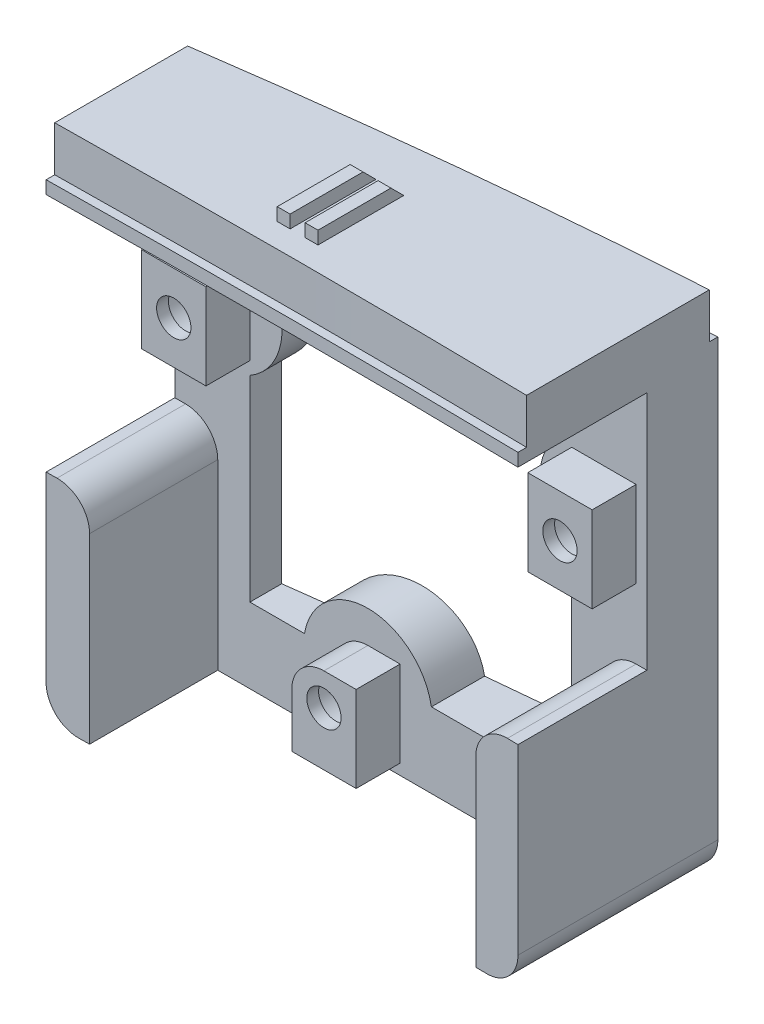
from build123d import *

# Parameters (mm, degrees)
BOSS_EXTRUDE2_DEPTH     = 47.8
CUT_EXTRUDE1_DEPTH      = 4.2
CUT_EXTRUDE2_START      = -5.4
CUT_EXTRUDE2_DEPTH      = 53.536189994
SKETCH3_R               = 2.5
CUT_EXTRUDE3_DEPTH      = 58.376025302
SKETCH4_W               = 6
SKETCH4_H               = 8
BOSS_EXTRUDE4_DEPTH     = 4.1
CUT_EXTRUDE6_DEPTH      = 58.376025302
CUT_EXTRUDE6_DEPTH_BACK = 58.376025302
SKETCH8_R               = 1.6
SKETCH10_8_R            = 2.7
SKETCH9_8_R             = 2.5
SKETCH10_9_R            = 2.7
SKETCH9_9_R             = 2.5
SKETCH12_R              = 2.5
CUT_EXTRUDE10_DEPTH     = 57.923372061
CUT_EXTRUDE11_START     = -1.2
SKETCH13_R              = 3
CUT_EXTRUDE11_DEPTH     = 57.176025302
CUT_EXTRUDE15_START     = -6.623319985
CUT_EXTRUDE15_DEPTH     = 6.623319985
SKETCH1_4_W             = 1.2
SKETCH1_4_H             = 8
BOSS_EXTRUDE5_DEPTH     = 1.2
BOSS_EXTRUDE6_START     = 42.4
BOSS_EXTRUDE6_DEPTH     = 20
FILLET1_R               = 3
CHAMFER1_SIZE           = 1.2


with BuildPart() as part:
    # Sketch1 → Boss-Extrude2 (new body)
    with BuildSketch(Plane(origin=(0, 0, 0), x_dir=(1, 0, 0), z_dir=(0, 1, 0))):
        with BuildLine():
            add(Edge.make_bspline(
                [(-29.373831617, 9.831440884), (-23.702910793, 10.644953131), (-13.407338059, 11.985082278), (1.281123888, 13.49777136), (10.220462704, 14.180602356), (14.626168383, 14.454760768)],
                knots=[0.119742515, 0.119742515, 0.119742515, 0.119742515, 0.136319699, 0.149951669, 0.163562333, 0.163562333, 0.163562333, 0.163562333], degree=3))
            Line((-29.373831617, 9.831440884), (-29.373831617, -4.168559116))
            add(Edge.make_bspline(
                [(14.626168383, -4.182978694), (12.933162782, -4.151781773), (2.223142231, -3.981238854), (-12.472719778, -3.968638532), (-25.439097931, -4.112708664), (-29.373831617, -4.168559116)],
                knots=[0.744962106, 0.744962106, 0.744962106, 0.744962106, 0.752707968, 0.793923307, 0.811910449, 0.811910449, 0.811910449, 0.811910449], degree=3))
            Line((14.626168383, -4.182978694), (14.626168383, 14.454760768))
        make_face()
    extrude(amount=-BOSS_EXTRUDE2_DEPTH)

    # Sketch1<3> → Cut-Extrude1 (cut)
    with BuildSketch(Plane(origin=(0, 0, 0), x_dir=(1, 0, 0), z_dir=(0, 1, 0))):
        with BuildLine():
            add(Edge.make_bspline(
                [(14.626168383, -3.382985836), (11.073485586, -3.317625516), (1.076994098, -3.185956595), (-13.61308178, -3.184990814), (-24.717461987, -3.302723406), (-29.373831617, -3.368729311)],
                knots=[0.744984429, 0.744984429, 0.744984429, 0.744984429, 0.761227479, 0.790619235, 0.811896601, 0.811896601, 0.811896601, 0.811896601], degree=3))
            Line((-29.373831617, -3.368729311), (-29.373831617, -4.168559116))
            add(Edge.make_bspline(
                [(14.626168383, -4.182978694), (12.933162782, -4.151781773), (2.223142231, -3.981238854), (-12.472719778, -3.968638532), (-25.439097931, -4.112708664), (-29.373831617, -4.168559116)],
                knots=[0.744962106, 0.744962106, 0.744962106, 0.744962106, 0.752707968, 0.793923307, 0.811910449, 0.811910449, 0.811910449, 0.811910449], degree=3))
            Line((14.626168383, -4.182978694), (14.626168383, -3.382985836))
        make_face()
        with BuildLine():
            add(Edge.make_bspline(
                [(-29.373831617, 9.831440884), (-23.702910793, 10.644953131), (-13.407338059, 11.985082278), (1.281123888, 13.49777136), (10.220462704, 14.180602356), (14.626168383, 14.454760768)],
                knots=[0.119742515, 0.119742515, 0.119742515, 0.119742515, 0.136319699, 0.149951669, 0.163562333, 0.163562333, 0.163562333, 0.163562333], degree=3))
            Line((-29.373831617, 9.831440884), (-29.373831617, 9.023325197))
            add(Edge.make_bspline(
                [(-29.373831617, 9.023325197), (-23.907676285, 9.80852946), (-11.876723061, 11.382311402), (2.777730924, 12.83368182), (11.866327435, 13.481222305), (14.626168383, 13.653256663)],
                knots=[0.119631072, 0.119631072, 0.119631072, 0.119631072, 0.13562759, 0.154970796, 0.163510366, 0.163510366, 0.163510366, 0.163510366], degree=3))
            Line((14.626168383, 13.653256663), (14.626168383, 14.454760768))
        make_face()
    extrude(amount=-CUT_EXTRUDE1_DEPTH, mode=Mode.SUBTRACT)

    # Sketch2 → Cut-Extrude2 (cut, through all)
    with BuildSketch(Plane(origin=(0, 0, 0), x_dir=(1, 0, 0), z_dir=(0, 1, 0)).offset(CUT_EXTRUDE2_START)):
        with BuildLine():
            Line((14.626168383, 7.831440884), (-29.373831617, 7.831440884))
            Line((-29.373831617, 7.831440884), (-29.373831617, -4.168559116))
            add(Edge.make_bspline(
                [(14.626168383, -4.182978694), (12.933162782, -4.151781773), (2.223142231, -3.981238854), (-12.472719778, -3.968638532), (-25.439097931, -4.112708664), (-29.373831617, -4.168559116)],
                knots=[0.744962106, 0.744962106, 0.744962106, 0.744962106, 0.752707968, 0.793923307, 0.811910449, 0.811910449, 0.811910449, 0.811910449], degree=3))
            Line((14.626168383, -4.182978694), (14.626168383, 7.831440884))
        make_face()
    extrude(amount=-CUT_EXTRUDE2_DEPTH, mode=Mode.SUBTRACT)

    # Sketch3 → Cut-Extrude3 (cut, through all)
    with BuildSketch(Plane.XY.offset(-7.831440884)):
        with Locations((-11.373831617, -41.8)):
            Circle(SKETCH3_R)
        with Locations((-25.373831617, -17.3)):
            Circle(SKETCH3_R)
        with Locations((10.626168383, -17.3)):
            Circle(SKETCH3_R)
    extrude(amount=-CUT_EXTRUDE3_DEPTH, mode=Mode.SUBTRACT)

    # Sketch4 → Boss-Extrude4 (add)
    with BuildSketch(Plane.XY.offset(-7.831440884)):
        with Locations((-25.373831617, -17.3)):
            Rectangle(SKETCH4_W, SKETCH4_H)
        with Locations((10.626168383, -17.3)):
            Rectangle(SKETCH4_W, SKETCH4_H)
        with BuildLine():
            Line((-14.373831617, -41.8), (-14.373831617, -46.8))
            Line((-14.373831617, -46.8), (-8.373831617, -46.8))
            Line((-8.373831617, -46.8), (-8.373831617, -38.8))
            Line((-8.373831617, -38.8), (-11.373831617, -38.8))
            ThreePointArc((-11.373831617, -38.8), (-13.49515196, -39.678679656), (-14.373831617, -41.8))
        make_face()
    extrude(amount=BOSS_EXTRUDE4_DEPTH)

    # Sketch8 → Cut-Extrude6 (cut, two sides: drawn at the far end of the back side and taken through both)
    with BuildSketch(Plane.XY.offset(-7.831440884).offset(-CUT_EXTRUDE6_DEPTH_BACK)):
        with Locations((10.626168383, -17.3)):
            Circle(SKETCH8_R)
        with Locations((-25.373831617, -17.3)):
            Circle(SKETCH8_R)
        with Locations((-11.373831617, -41.8)):
            Circle(SKETCH8_R)
    extrude(amount=CUT_EXTRUDE6_DEPTH + CUT_EXTRUDE6_DEPTH_BACK, mode=Mode.SUBTRACT)

    # Cut-Loft2: read off the stored shape, not the designer's step
    # Cut-Loft2: loft between two sections, ruled curve by curve
    cut_loft2_from = [
        Edge.make_bspline([(9.662208402, -19.60668185, -8.031440884), (5.048844703, -17.678761888, -8.031440884), (6.976764664, -13.065398189, -8.031440884), (11.590128364, -14.99331815, -8.031440884), (16.203492063, -16.921238112, -8.031440884), (14.275572102, -21.534601811, -8.031440884), (9.662208402, -19.60668185, -8.031440884)], [0, 0, 0, 0, 0.5, 0.5, 0.5, 1, 1, 1, 1], 3, [1, 0.333333333, 0.333333333, 1, 0.333333333, 0.333333333, 1]),
    ]
    cut_loft2_to = [
        Edge.make_bspline([(10.826167318, -19.992582483, -9.031440884), (5.441002353, -20.392580352, -9.031440884), (5.041004483, -15.007415387, -9.031440884), (10.426169448, -14.607417517, -9.031440884), (15.811334414, -14.207419648, -9.031440884), (16.211332283, -19.592584613, -9.031440884), (10.826167318, -19.992582483, -9.031440884)], [0, 0, 0, 0, 0.5, 0.5, 0.5, 1, 1, 1, 1], 3, [1, 0.333333333, 0.333333333, 1, 0.333333333, 0.333333333, 1]),
    ]
    cut_loft2 = Solid(Shell([*[Face.make_surface_from_curves(cut_loft2_from[k], cut_loft2_to[k]) for k in range(1)], Face(Wire(cut_loft2_from)), Face(Wire(cut_loft2_to))]))
    add(cut_loft2, mode=Mode.SUBTRACT)

    # Sketch10<8> → Cut-Loft3 section 0
    with BuildSketch(Plane.XY.offset(-9.031440884)):
        with Locations((-25.373831617, -17.3)):
            Circle(SKETCH10_8_R)
    # Sketch9<8> → Cut-Loft3 section 1
    with BuildSketch(Plane.XY.offset(-8.031440884)):
        with Locations((-25.373831617, -17.3)):
            Circle(SKETCH9_8_R)
    loft(mode=Mode.SUBTRACT)

    # Sketch10<9> → Cut-Loft4 section 0
    with BuildSketch(Plane.XY.offset(-9.031440884)):
        with Locations((-11.373831617, -41.8)):
            Circle(SKETCH10_9_R)
    # Sketch9<9> → Cut-Loft4 section 1
    with BuildSketch(Plane.XY.offset(-8.031440884)):
        with Locations((-11.373831617, -41.8)):
            Circle(SKETCH9_9_R)
    loft(mode=Mode.SUBTRACT)

    # Sketch12 → Cut-Extrude10 (cut, through all)
    with BuildSketch(Plane.XY.offset(-4.831440884)):
        with Locations((-25.373831617, -17.3)):
            Circle(SKETCH12_R)
        with Locations((10.626168383, -17.3)):
            Circle(SKETCH12_R)
        with Locations((-11.373831617, -41.8)):
            Circle(SKETCH12_R)
    extrude(amount=-CUT_EXTRUDE10_DEPTH, mode=Mode.SUBTRACT)

    # Sketch13 → Cut-Extrude11 (cut, through all)
    with BuildSketch(Plane.XY.offset(-7.831440884).offset(CUT_EXTRUDE11_START)):
        with Locations((-25.373831617, -17.3)):
            Circle(SKETCH13_R)
        with Locations((10.626168383, -17.3)):
            Circle(SKETCH13_R)
        with Locations((-11.373831617, -41.8)):
            Circle(SKETCH13_R)
    extrude(amount=-CUT_EXTRUDE11_DEPTH, mode=Mode.SUBTRACT)

    # Cut-Extrude15: read off the stored shape, not the designer's step
    # Cut-Extrude15 outline → Cut-Extrude15 (cut)
    with BuildSketch(Plane.XY.offset(-7.831440884).offset(CUT_EXTRUDE15_START)):
        with BuildLine():
            ThreePointArc((-22.373831617, -12.103847577), (-19.373831617, -17.3), (-22.373831617, -22.496152423))
            Line((-22.373831617, -22.496152423), (-22.373831617, -40.8))
            Line((-22.373831617, -40.8), (-17.2899114, -40.8))
            ThreePointArc((-17.2899114, -40.8), (-11.373831617, -35.8), (-5.457751834, -40.8))
            Line((-5.457751834, -40.8), (7.626168383, -40.8))
            Line((7.626168383, -40.8), (7.626168383, -22.496152423))
            ThreePointArc((7.626168383, -22.496152423), (4.626168383, -17.3), (7.626168383, -12.103847577))
            Line((7.626168383, -12.103847577), (7.626168383, -6.2))
            Line((7.626168383, -6.2), (-22.373831617, -6.2))
            Line((-22.373831617, -6.2), (-22.373831617, -12.103847577))
        make_face()
    extrude(amount=CUT_EXTRUDE15_DEPTH, mode=Mode.SUBTRACT)

    # Sketch1<4> → Boss-Extrude5 (add)
    with BuildSketch(Plane(origin=(0, 0, 0), x_dir=(1, 0, 0), z_dir=(0, 1, 0))):
        with Locations((-10.430289862, 3.031440884)):
            Rectangle(SKETCH1_4_W, SKETCH1_4_H)
        with Locations((-7.830289862, 3.031440884)):
            Rectangle(SKETCH1_4_W, SKETCH1_4_H)
    extrude(amount=BOSS_EXTRUDE5_DEPTH)

    # Sketch17 → Boss-Extrude6 (add)
    with BuildSketch(Plane.XZ.offset(5.4).offset(BOSS_EXTRUDE6_START)):
        with BuildLine():
            Line((-29.373831617, 4.168559116), (-29.373831617, -7.831440884))
            Line((-29.373831617, -7.831440884), (-25.373831617, -7.831440884))
            Line((-25.373831617, -7.831440884), (-25.373831617, 4.116049394))
            add(Edge.make_bspline(
                [(-25.373831617, 4.116049394), (-26.707658003, 4.132108499), (-28.041018162, 4.149640877), (-29.373831617, 4.168559116)],
                knots=[0.805817659, 0.805817659, 0.805817659, 0.805817659, 0.811910449, 0.811910449, 0.811910449, 0.811910449], degree=3))
        make_face()
        with BuildLine():
            add(Edge.make_bspline(
                [(14.626168383, 4.182978694), (13.293610604, 4.158423725), (11.9602081, 4.136480858), (10.626168383, 4.117063039)],
                knots=[0.744962106, 0.744962106, 0.744962106, 0.744962106, 0.751058842, 0.751058842, 0.751058842, 0.751058842], degree=3))
            Line((10.626168383, 4.117063039), (10.626168383, -7.831440884))
            Line((10.626168383, -7.831440884), (14.626168383, -7.831440884))
            Line((14.626168383, -7.831440884), (14.626168383, 4.182978694))
        make_face()
    extrude(amount=-BOSS_EXTRUDE6_DEPTH)

    # Fillet1
    fillet1_edges = [part.edges().sort_by_distance(p)[0] for p in [
        (-29.373831617, -47.8, -2.831440884),
        (14.626168383, -47.8, -5.135891037),
        (10.626168383, -27.8, -1.857188922),
        (-25.373831617, -27.8, -1.857695745),
    ]]
    fillet(fillet1_edges, radius=FILLET1_R)

    # Chamfer1
    chamfer1_edges = [part.edges().sort_by_distance(p)[0] for p in [
        (-7.830289862, 1.2, -7.031440884),
        (-10.430289862, 1.2, -7.031440884),
    ]]
    chamfer(chamfer1_edges, length=CHAMFER1_SIZE - 0.0001)  # a hair under: the kernel refuses the full size


solid = part.part
